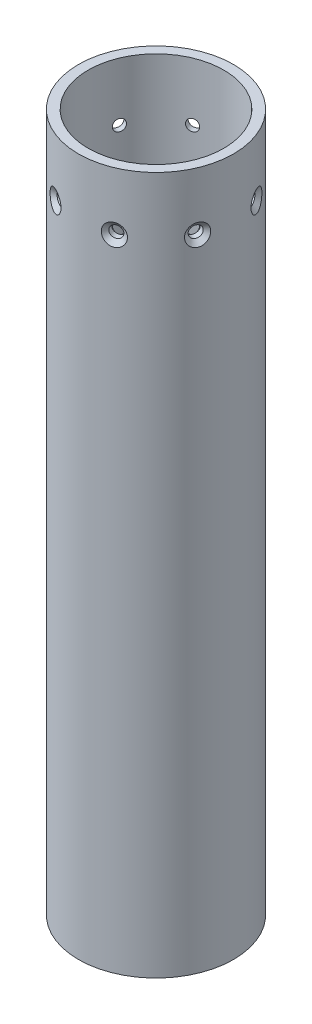
from build123d import *

# Parameters (mm, degrees)
SKETCH1_R              = 25.4
SKETCH1_R_2            = 22.225
BODY_DEPTH             = 228.6
TOP_BOLT_PATTERN_COUNT = 8


with BuildPart() as part:
    # Sketch1 → body (new body)
    with BuildSketch(Plane(origin=(0, 0, 0), x_dir=(1, 0, 0), z_dir=(0, 1, 0))):
        Circle(SKETCH1_R)
        Circle(SKETCH1_R_2, mode=Mode.SUBTRACT)
    extrude(amount=BODY_DEPTH)

    # Sketch4 → CSK for _6 Flat Head Machine Screw _100 (revolve, cut)
    with BuildSketch(Plane(origin=(9.720159182, 209.55, -23.466540126), x_dir=(-0.9238795325112865, 0, -0.3826834323650906), z_dir=(0, 1, 0))):
        Polygon((0, 0), (0, 4.315824014), (1.89865, 3.175), (1.89865, 1.380025208), (3.5433, 0), align=None)
    csk_for_6_flat_head_machine_screw_100 = revolve(axis=Axis((12.150198978, 209.55, -29.333175157), (-0.38268343236509056, 0, 0.9238795325112865)), mode=Mode.SUBTRACT)

    # top-bolt-pattern: CSK for _6 Flat Head Machine Screw _100 ×8 about axis
    top_bolt_pattern_axis = Axis((0, 228.6, 0), (0, -1, 0))
    for i in range(1, TOP_BOLT_PATTERN_COUNT):
        add(csk_for_6_flat_head_machine_screw_100.rotate(top_bolt_pattern_axis, i * 360 / TOP_BOLT_PATTERN_COUNT), mode=Mode.SUBTRACT)


solid = part.part
